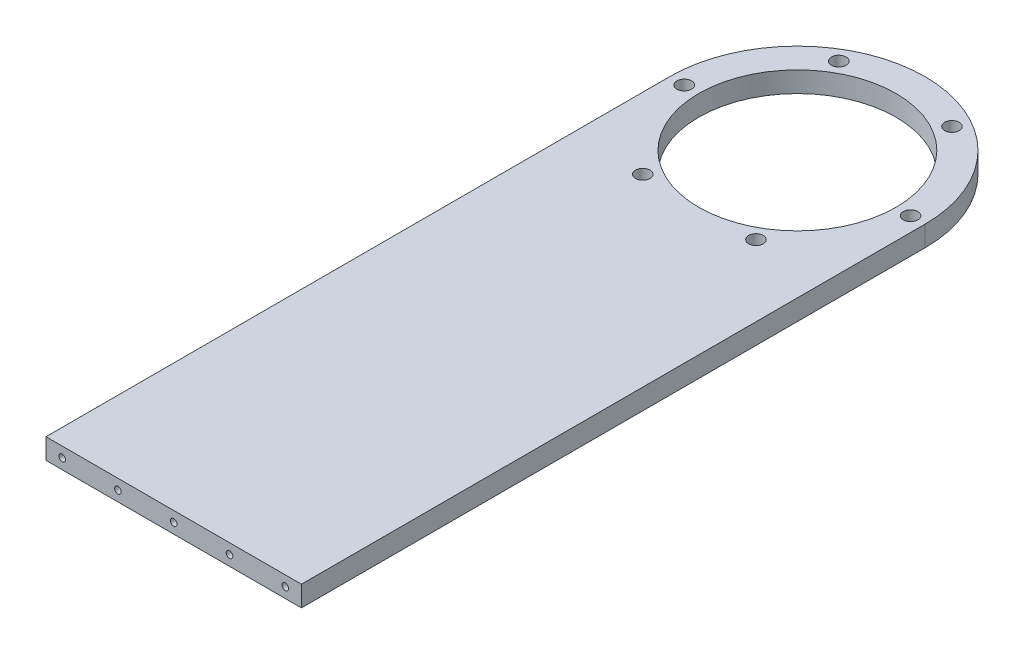
from build123d import *

# Parameters (mm, degrees)
BOSS_EXTRUDE1_OUTLINE_R      = 2.25
BOSS_EXTRUDE1_OUTLINE_R_2    = 30.5
BOSS_EXTRUDE1_DEPTH          = 6.35
M2_5X0_45_TAPPED_HOLE1_D     = 2.05
M2_5X0_45_TAPPED_HOLE1_DEPTH = 6.35
M2_5X0_45_TAPPED_HOLE1_TIP   = 0.615882135


# Read off the part's stored shape, not the designer's step: Boss-Extrude1
with BuildPart() as part:
    # Boss-Extrude1 outline → Boss-Extrude1 (new body)
    with BuildSketch(Plane(origin=(0, 0, 0), x_dir=(1, 0, 0), z_dir=(0, 1, 0))):
        with BuildLine():
            ThreePointArc((39.5, 96.444999522), (2.39e-07, 135.945), (-39.5, 96.445))
            Line((-39.5, 96.445), (-39.500001167, -96.445))
            Line((-39.500001167, -96.445), (39.499998833, -96.445000478))
            Line((39.499998833, -96.445000478), (39.5, 96.444999522))
        make_face()
        with Locations((-17.5, 66.134110868)):
            Circle(BOSS_EXTRUDE1_OUTLINE_R, mode=Mode.SUBTRACT)
        with Locations((-35, 96.445)):
            Circle(BOSS_EXTRUDE1_OUTLINE_R, mode=Mode.SUBTRACT)
        with Locations((-17.5, 126.755889132)):
            Circle(BOSS_EXTRUDE1_OUTLINE_R, mode=Mode.SUBTRACT)
        with Locations((17.5, 66.134110868)):
            Circle(BOSS_EXTRUDE1_OUTLINE_R, mode=Mode.SUBTRACT)
        with Locations((0, 96.445)):
            Circle(BOSS_EXTRUDE1_OUTLINE_R_2, mode=Mode.SUBTRACT)
        with Locations((17.5, 126.755889132)):
            Circle(BOSS_EXTRUDE1_OUTLINE_R, mode=Mode.SUBTRACT)
        with Locations((35, 96.445)):
            Circle(BOSS_EXTRUDE1_OUTLINE_R, mode=Mode.SUBTRACT)
    extrude(amount=BOSS_EXTRUDE1_DEPTH)

    # M2.5x0.45 Tapped Hole1
    with Locations(Plane(origin=(-5.84e-07, 0, 96.445000239), x_dir=(1.0, 0, 6.0503381489132905e-09), z_dir=(-6.0503381489132905e-09, 0, 1.0))):
        with Locations((0, 3.175), (17.249999708, 3.175), (34.499999416, 3.175), (-17.249999708, 3.175), (-34.499999416, 3.175)):
            Hole(M2_5X0_45_TAPPED_HOLE1_D / 2, depth=M2_5X0_45_TAPPED_HOLE1_DEPTH)
            with Locations((0, 0, -(M2_5X0_45_TAPPED_HOLE1_DEPTH + M2_5X0_45_TAPPED_HOLE1_TIP / 2))):  # 118° drill point
                Cone(0, M2_5X0_45_TAPPED_HOLE1_D / 2, M2_5X0_45_TAPPED_HOLE1_TIP, mode=Mode.SUBTRACT)


solid = part.part
